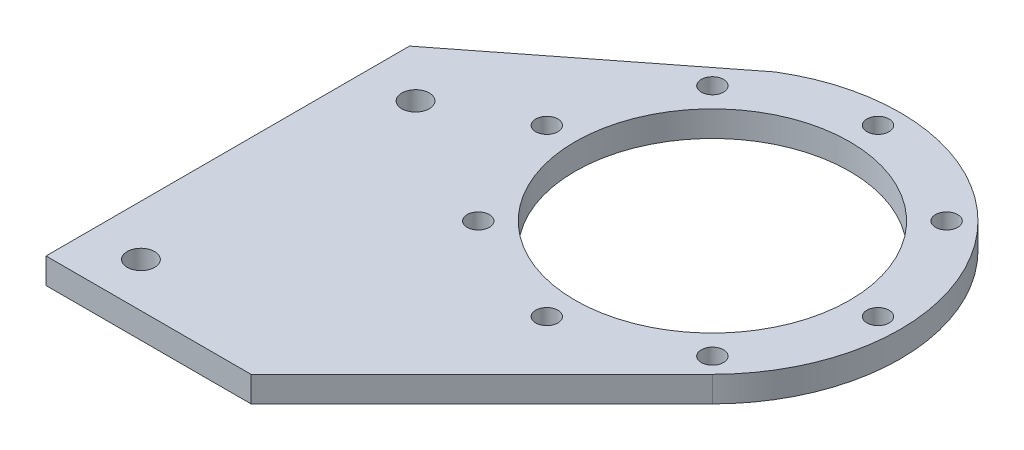
from build123d import *

# Parameters (mm, degrees)
BASE_FLANGE1_DEPTH = 6.35
SKETCH8_R          = 3.4
CUT_EXTRUDE1_DEPTH = 183.851914127
SKETCH9_R          = 34
CUT_EXTRUDE2_DEPTH = 183.851914127
SKETCH10_R         = 2.75
CUT_EXTRUDE3_DEPTH = 183.851914127


# Sheet-metal steps are written as plain solids
with BuildPart() as part:
    # Sketch2 → Base-Flange1 (new body)
    with BuildSketch(Plane(origin=(0, 0, 0), x_dir=(1, 0, 0), z_dir=(0, 1, 0))):
        with BuildLine():
            Line((0, 0), (50.76093065, 0))
            Line((50.76093065, 0), (107.880465325, 57.119534675))
            ThreePointArc((107.880465325, 57.119534675), (111.537953618, 118.761570635), (50.76093065, 129.682710556))
            Line((50.76093065, 129.682710556), (0, 90))
            Line((0, 90), (0, 0))
        make_face()
    extrude(amount=-BASE_FLANGE1_DEPTH)

    # Sketch8 → Cut-Extrude1 (cut, through all)
    with BuildSketch(Plane(origin=(0, 0, 0), x_dir=(1, 0, 0), z_dir=(0, 1, 0))):
        with Locations(Location((12.5, 79, 0), (0, 0, 270))):
            Circle(SKETCH8_R)
        with Locations(Location((12.5, 11, 0), (0, 0, 90))):
            Circle(SKETCH8_R)
    extrude(amount=-CUT_EXTRUDE1_DEPTH, mode=Mode.SUBTRACT)

    # Sketch9 → Cut-Extrude2 (cut, through all)
    with BuildSketch(Plane(origin=(0, 0, 0), x_dir=(1, 0, 0), z_dir=(0, 1, 0))):
        with Locations(Location((75, 90, 0), (0, 0, 270))):
            Circle(SKETCH9_R)
    extrude(amount=-CUT_EXTRUDE2_DEPTH, mode=Mode.SUBTRACT)

    # Sketch10 → Cut-Extrude3 (cut, through all)
    with BuildSketch(Plane(origin=(0, 0, 0), x_dir=(1, 0, 0), z_dir=(0, 1, 0))):
        with Locations(Location((75, 131, 0), (0, 0, 270))):
            Circle(SKETCH10_R)
        with Locations(Location((103.991378029, 118.991378029, 0), (0, 0, 270))):
            Circle(SKETCH10_R)
        with Locations(Location((116, 90, 0), (0, 0, 270))):
            Circle(SKETCH10_R)
        with Locations(Location((103.991378029, 61.008621971, 0), (0, 0, 270))):
            Circle(SKETCH10_R)
        with Locations(Location((75, 49, 0), (0, 0, 270))):
            Circle(SKETCH10_R)
        with Locations(Location((46.008621971, 61.008621971, 0), (0, 0, 270))):
            Circle(SKETCH10_R)
        with Locations(Location((34, 90, 0), (0, 0, 270))):
            Circle(SKETCH10_R)
        with Locations(Location((46.008621971, 118.991378029, 0), (0, 0, 270))):
            Circle(SKETCH10_R)
    extrude(amount=-CUT_EXTRUDE3_DEPTH, mode=Mode.SUBTRACT)


solid = part.part
